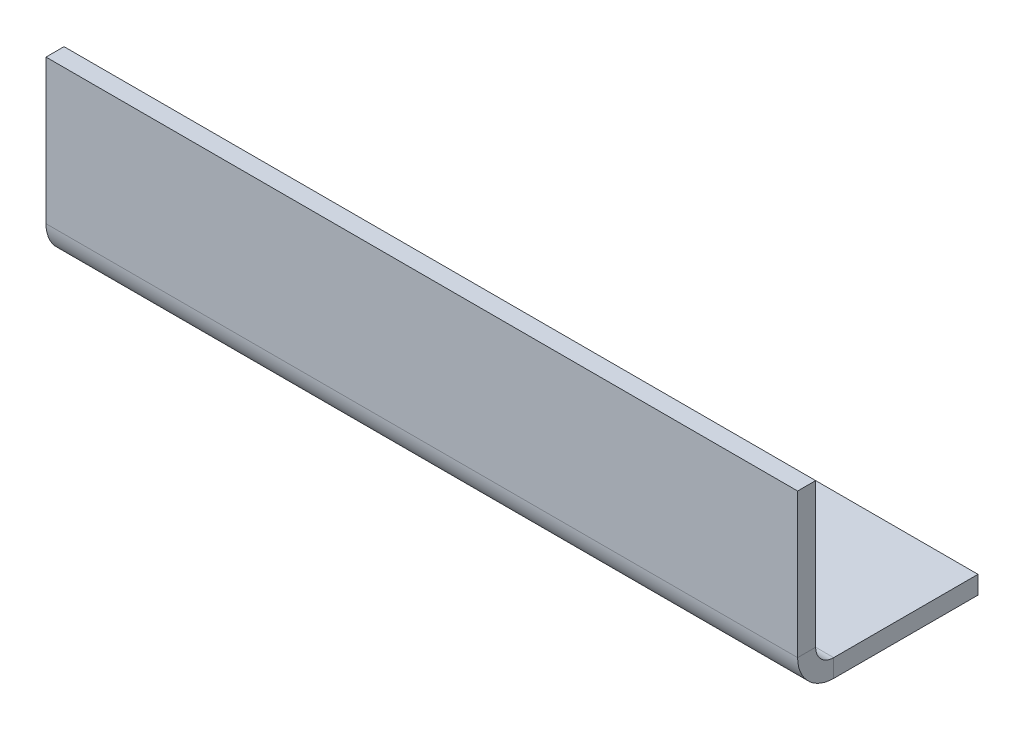
from build123d import *

# Parameters (mm, degrees)
SKETCH1_W                    = 250
SKETCH1_H                    = 60
BOSS_EXTRUDE1_DEPTH          = 4
CONVERT_SOLID1_START         = -125
CONVERT_SOLID1_OUTLINE_W     = 2
CONVERT_SOLID1_OUTLINE_H     = 60
CONVERT_SOLID1_DEPTH         = 250
EDGE_FLANGE1_STRIP_W         = 36
EDGE_FLANGE1_STRIP_H         = 6
EDGE_FLANGE1_STRIP_CUT_DEPTH = 250
EDGE_FLANGE1_DEPTH           = 250


# Read off the part's stored shape, not the designer's step: Convert-Solid1
# Sheet-metal steps are written as plain solids
with BuildPart() as part:
    # Sketch1 → Boss-Extrude1 (new body)
    with BuildSketch(Plane(origin=(0, 0, 0), x_dir=(1, 0, 0), z_dir=(0, 1, 0))):
        Rectangle(SKETCH1_W, SKETCH1_H)
    extrude(amount=BOSS_EXTRUDE1_DEPTH)

    # Convert-Solid1 outline → Convert-Solid1 (add)
    with BuildSketch(Plane.YZ.offset(CONVERT_SOLID1_START)):
        with Locations((-1, 0)):
            Rectangle(CONVERT_SOLID1_OUTLINE_W, CONVERT_SOLID1_OUTLINE_H)
    extrude(amount=CONVERT_SOLID1_DEPTH)

    # Edge-Flange1 strip (across the edge) → Edge-Flange1 strip cut (cut)
    with BuildSketch(Plane(origin=(-125, 4, 30), x_dir=(0, 0, -1), z_dir=(1, 0, 0))):
        with Locations((-6, -3)):
            Rectangle(EDGE_FLANGE1_STRIP_W, EDGE_FLANGE1_STRIP_H)
    extrude(amount=EDGE_FLANGE1_STRIP_CUT_DEPTH, mode=Mode.SUBTRACT)

    # Edge-Flange1 section (across the edge) → Edge-Flange1 (add)
    with BuildSketch(Plane(origin=(-125, 4, 30), x_dir=(0, 0, -1), z_dir=(1, 0, 0))):
        with BuildLine():
            Line((0, 6), (0, 54))
            Line((0, 54), (6, 54))
            Line((6, 54), (6, 6))
            ThreePointArc((6, 6), (7.757359313, 1.757359313), (12, 0))
            Line((12, 0), (12, -6))
            ThreePointArc((12, -6), (3.514718626, -2.485281374), (0, 6))
        make_face()
    extrude(amount=EDGE_FLANGE1_DEPTH)


solid = part.part
